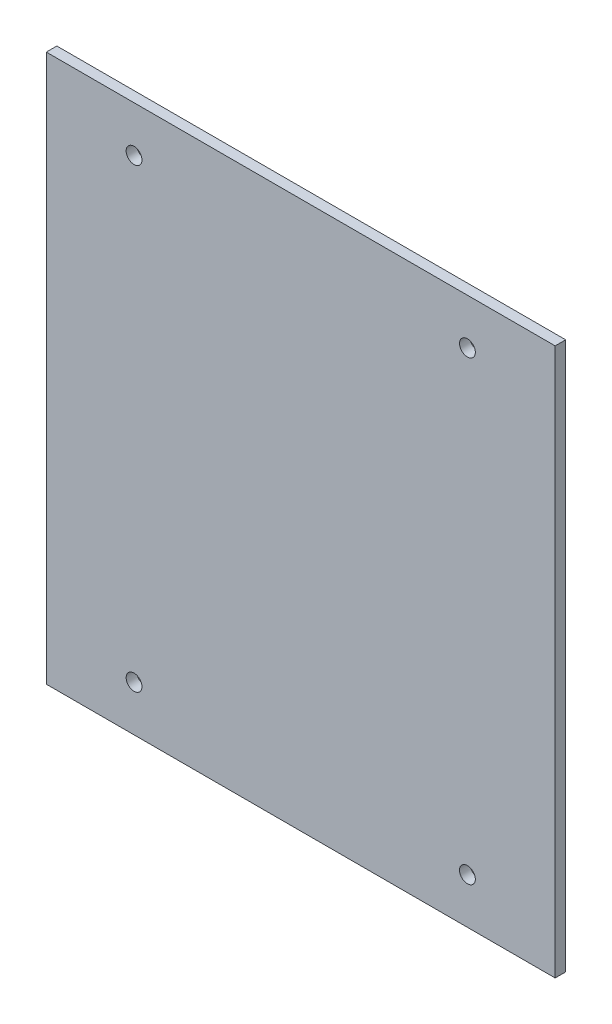
from build123d import *

# Parameters (mm, degrees)
SKIZZE1_W                       = 145
SKIZZE1_H                       = 156
AUFSATZ_LINEAR_AUSTRAGEN1_DEPTH = 3
DURCHGANGSLOCH_F_R_M41_D        = 4.5
DURCHGANGSLOCH_F_R_M41_DEPTH    = 3
DURCHGANGSLOCH_F_R_M41_TIP      = 1.351936393


with BuildPart() as part:
    # Skizze1 → Aufsatz-Linear austragen1 (new body)
    with BuildSketch(Plane.XY):
        Rectangle(SKIZZE1_W, SKIZZE1_H)
    extrude(amount=AUFSATZ_LINEAR_AUSTRAGEN1_DEPTH)

    # Durchgangsloch für M41
    with Locations(Plane.XY.offset(3)):
        with Locations((-47.5, -65), (47.5, -65), (47.5, 65), (-47.5, 65)):
            Hole(DURCHGANGSLOCH_F_R_M41_D / 2, depth=DURCHGANGSLOCH_F_R_M41_DEPTH)
            with Locations((0, 0, -(DURCHGANGSLOCH_F_R_M41_DEPTH + DURCHGANGSLOCH_F_R_M41_TIP / 2))):  # 118° drill point
                Cone(0, DURCHGANGSLOCH_F_R_M41_D / 2, DURCHGANGSLOCH_F_R_M41_TIP, mode=Mode.SUBTRACT)


solid = part.part
